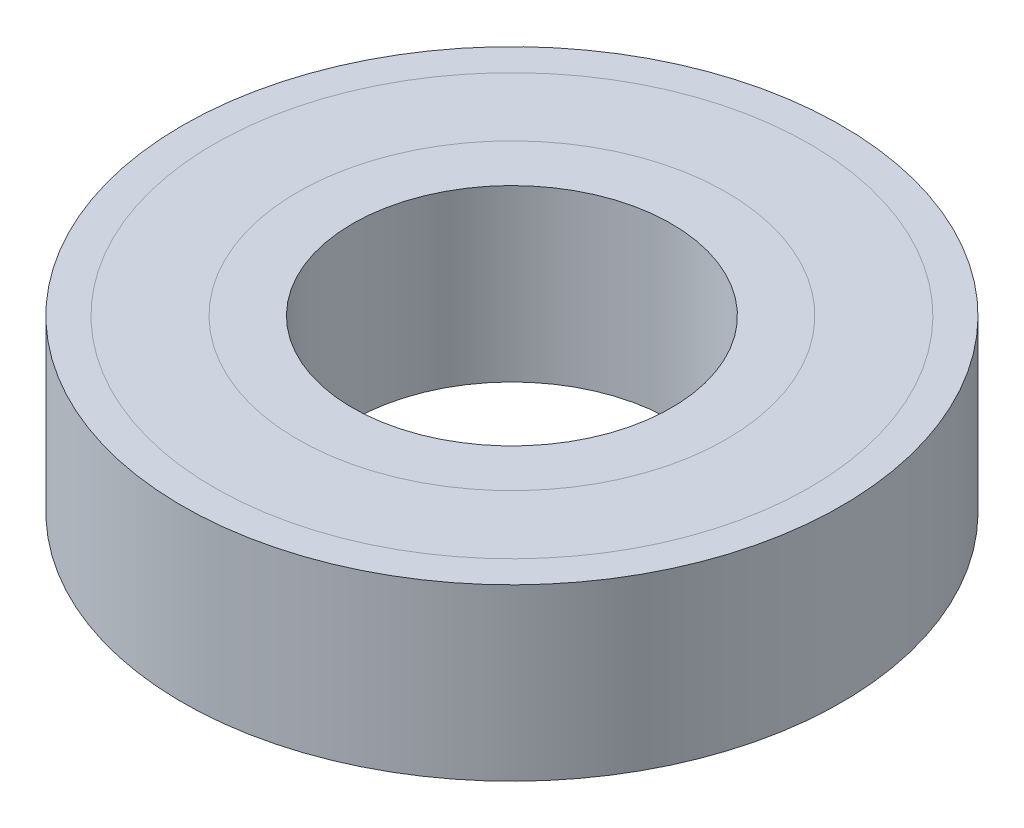
from build123d import *

# Parameters (mm, degrees)
SKETCH1_W = 16
SKETCH1_H = 16


with BuildPart() as part:
    # Sketch1 → Revolve1 (revolve)
    with BuildSketch(Plane.XY):
        with Locations((23, 0)):
            Rectangle(SKETCH1_W, SKETCH1_H)
    revolve(axis=Axis((0, 8, 0), (0, -1, 0)))


solid = part.part
